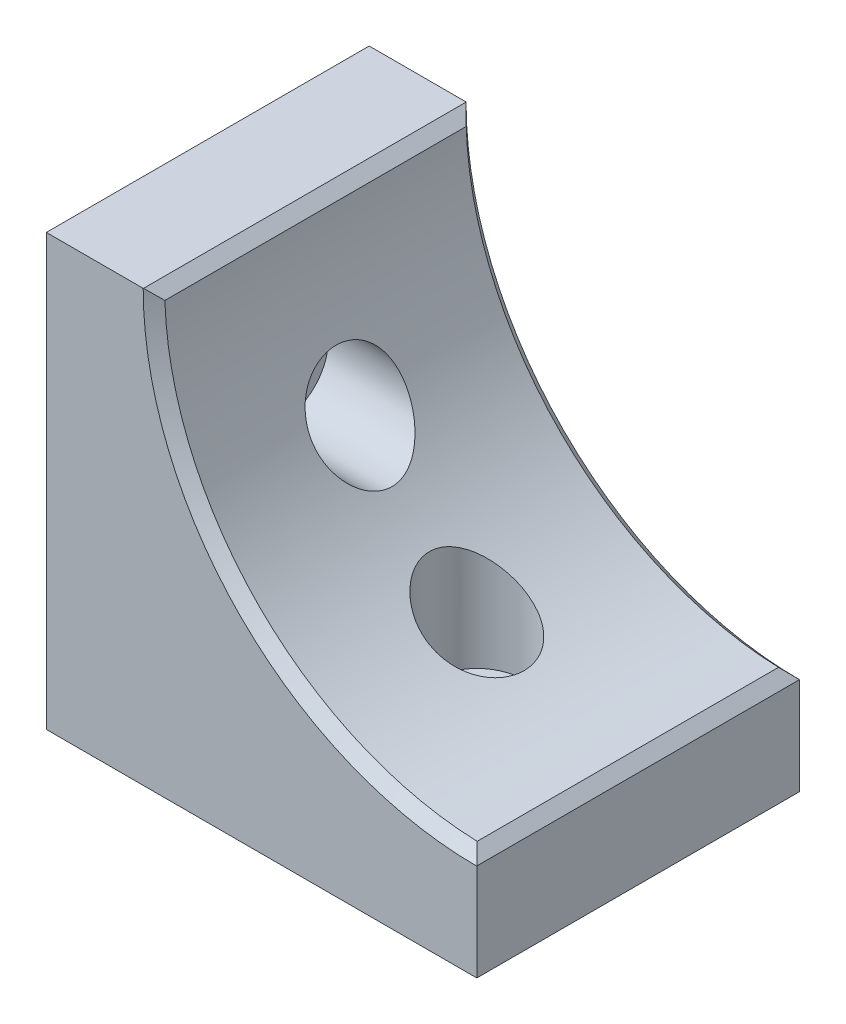
from build123d import *

# Parameters (mm, degrees)
SKETCH1_W           = 50.8
SKETCH1_H           = 38.1
BOSS_EXTRUDE1_DEPTH = 50.8
SKETCH2_W           = 38.1
SKETCH2_H           = 38.1
CUT_EXTRUDE1_DEPTH  = 38.1
SKETCH3_R           = 5.588
CUT_EXTRUDE2_DEPTH  = 4.064
SKETCH4_R           = 3.302
CUT_EXTRUDE3_DEPTH  = 8.636
SKETCH5_R           = 5.588
CUT_EXTRUDE4_DEPTH  = 4.064
SKETCH6_R           = 3.302
CUT_EXTRUDE5_DEPTH  = 8.636
FILLET1_R           = 38.1


with BuildPart() as part:
    # Sketch1 → Boss-Extrude1 (new body)
    with BuildSketch(Plane(origin=(0, 0, 0), x_dir=(1, 0, 0), z_dir=(0, 1, 0))):
        with Locations((25.4, -19.05)):
            Rectangle(SKETCH1_W, SKETCH1_H)
    extrude(amount=BOSS_EXTRUDE1_DEPTH)

    # Sketch2 → Cut-Extrude1 (cut)
    with BuildSketch(Plane.XY.offset(38.1)):
        with Locations((31.75, 31.75)):
            Rectangle(SKETCH2_W, SKETCH2_H)
    extrude(amount=-CUT_EXTRUDE1_DEPTH, mode=Mode.SUBTRACT)

    # Sketch3 → Cut-Extrude2 (cut)
    with BuildSketch(Plane(origin=(0, 12.7, 0), x_dir=(1, 0, 0), z_dir=(0, 1, 0))):
        with Locations(Location((31.75, -19.05, 0), (0, 0, 270))):
            Circle(SKETCH3_R)
    extrude(amount=-CUT_EXTRUDE2_DEPTH, mode=Mode.SUBTRACT)

    # Sketch4 → Cut-Extrude3 (cut)
    with BuildSketch(Plane(origin=(0, 8.636, 0), x_dir=(1, 0, 0), z_dir=(0, 1, 0))):
        with Locations(Location((31.75, -19.05, 0), (0, 0, 270))):
            Circle(SKETCH4_R)
    extrude(amount=-CUT_EXTRUDE3_DEPTH, mode=Mode.SUBTRACT)

    # Sketch5 → Cut-Extrude4 (cut)
    with BuildSketch(Plane(origin=(12.7, 0, 0), x_dir=(0, 0, -1), z_dir=(1, 0, 0))):
        with Locations(Location((-19.05, 31.75, 0), (0, 0, 90))):
            Circle(SKETCH5_R)
    extrude(amount=-CUT_EXTRUDE4_DEPTH, mode=Mode.SUBTRACT)

    # Sketch6 → Cut-Extrude5 (cut)
    with BuildSketch(Plane(origin=(8.636, 0, 0), x_dir=(0, 0, -1), z_dir=(1, 0, 0))):
        with Locations(Location((-19.05, 31.75, 0), (0, 0, 90))):
            Circle(SKETCH6_R)
    extrude(amount=-CUT_EXTRUDE5_DEPTH, mode=Mode.SUBTRACT)

    # Fillet1
    # the kernel refuses this fillet: 38.1 mm, written as the material it adds along each edge
    with BuildSketch(Plane(origin=(12.7, 12.7, 38.1), x_dir=(0, 1, 0), z_dir=(0, 0, -1))) as fillet1_piece_1_section:
        with BuildLine():
            CenterArc((FILLET1_R, FILLET1_R), FILLET1_R, 180, 90)
            Line((0, FILLET1_R), (0, 0))
            Line((0, 0), (FILLET1_R, 0))
        make_face()
    fillet1_piece_1 = extrude(amount=38.1, mode=Mode.PRIVATE)
    fillet1_piece_1 = fillet1_piece_1 - Plane(origin=(21.164766811, 31.75, 19.05), x_dir=(0, 1, 0), z_dir=(1, 0, 0)) * Cylinder(5.588, 229, mode=Mode.PRIVATE)
    fillet1_piece_1 = fillet1_piece_1 - Plane(origin=(31.75, 21.164747652, 19.05), x_dir=(0, 0, 1), z_dir=(0, 1, 0)) * Cylinder(5.588, 229, mode=Mode.PRIVATE)
    add(fillet1_piece_1)

    # Chamfer1
    # the kernel refuses this chamfer: 1.27 mm, written as the material it takes off along each edge
    with BuildSketch(Plane(origin=(50.8, 12.7, 41.316229993), x_dir=(-0.9990092495059921, 0.04450302687991344, 0), z_dir=(0, 0, -1))) as chamfer1_piece_1:
        with BuildLine():
            Line((1.265623079, 0), (-0.09253308, -1.283159884))
            Line((-0.09253308, -1.283159884), (-0.117907915, -1.282029507))
            ThreePointArc((-0.117907915, -1.282029507), (-0.053990428, -0.641235865), (-0.025374835, 0.001130377))
            Line((-0.025374835, 0.001130377), (0.001130377, 0.025374835))
            ThreePointArc((0.001130377, 0.025374835), (0.632880934, 0.002485367), (1.265934324, 0.025398093))
            Line((1.265934324, 0.025398093), (1.265623079, 0))
        make_face()
    extrude(amount=44.532459986, mode=Mode.SUBTRACT)
    with BuildSketch(Plane(origin=(12.7, 50.8, 41.316229993), x_dir=(0.04450302687991419, -0.9990092495059921, 0), z_dir=(0, 0, -1))) as chamfer1_piece_2:
        with BuildLine():
            Line((1.265623079, 0), (-0.09253308, 1.283159884))
            Line((-0.09253308, 1.283159884), (-0.117907915, 1.282029507))
            ThreePointArc((-0.117907915, 1.282029507), (-0.053990428, 0.641235865), (-0.025374835, -0.001130377))
            Line((-0.025374835, -0.001130377), (0.001130377, -0.025374835))
            ThreePointArc((0.001130377, -0.025374835), (0.632880934, -0.002485367), (1.265934324, -0.025398093))
            Line((1.265934324, -0.025398093), (1.265623079, 0))
        make_face()
    extrude(amount=44.532459986, mode=Mode.SUBTRACT)
    with BuildSketch(Plane(origin=(50.8, 50.8, 38.1), x_dir=(0.08565212644692491, -0.9963251041879453, 0), z_dir=(0.9963251041879453, 0.08565212644692491, 0))) as chamfer1_piece_3:
        with BuildLine():
            Line((38.064078976, 1.305921024), (39.405921024, -0.035921024))
            Line((39.405921024, -0.035921024), (39.405921024, -0.061321024))
            ThreePointArc((39.405921024, -0.061321024), (38.752960512, -0.0254), (38.1, -0.0254))
            Line((38.1, -0.0254), (38.0746, 0))
            ThreePointArc((38.0746, 0), (38.0746, 0.652960512), (38.038678976, 1.305921024))
            Line((38.038678976, 1.305921024), (38.064078976, 1.305921024))
        make_face()
    revolve(axis=Axis((50.8, 50.8, 38.1), (0, 0, -1)), revolution_arc=99.827051452, mode=Mode.SUBTRACT)
    with BuildSketch(Plane(origin=(50.8, 50.8, 0), x_dir=(0.08565212644692491, -0.9963251041879453, 0), z_dir=(0.9963251041879453, 0.08565212644692491, 0))) as chamfer1_piece_4:
        with BuildLine():
            Line((38.064078976, -1.305921024), (39.405921024, 0.035921024))
            Line((39.405921024, 0.035921024), (39.405921024, 0.061321024))
            ThreePointArc((39.405921024, 0.061321024), (38.752960512, 0.0254), (38.1, 0.0254))
            Line((38.1, 0.0254), (38.0746, 0))
            ThreePointArc((38.0746, 0), (38.0746, -0.652960512), (38.038678976, -1.305921024))
            Line((38.038678976, -1.305921024), (38.064078976, -1.305921024))
        make_face()
    revolve(axis=Axis((50.8, 50.8, 0), (0, 0, -1)), revolution_arc=99.827051452, mode=Mode.SUBTRACT)


solid = part.part
